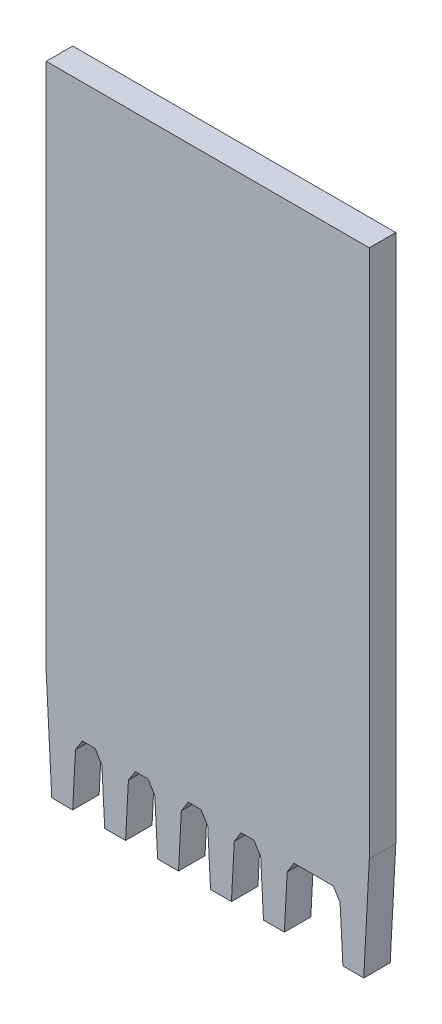
from build123d import *

# Parameters (mm, degrees)
BOSS_EXTRUDE1_DEPTH = 1.5


with BuildPart() as part:
    # Sketch1 → Boss-Extrude1 (new body)
    with BuildSketch(Plane.XY):
        Polygon((0, 6), (0.314446676, 0), (1.497941481, 0), (1.657221927, 3.039251967), (2.042586863, 3.65596478), (2.769801294, 3.65596478), (3.155166229, 3.039251967), (3.314446676, 0), (4.497941481, 0), (4.657221927, 3.039251967), (5.042586863, 3.65596478), (5.769801294, 3.65596478), (6.155166229, 3.039251967), (6.314446676, 0), (7.497941481, 0), (7.657221927, 3.039251967), (8.042586863, 3.65596478), (8.769801294, 3.65596478), (9.155166229, 3.039251967), (9.314446676, 0), (10.497941481, 0), (10.657221927, 3.039251967), (11.042586863, 3.65596478), (11.769801294, 3.65596478), (12.155166229, 3.039251967), (12.314446676, 0), (13.497941481, 0), (13.657221927, 3.039251967), (14.042586863, 3.65596478), (16.269801294, 3.65596478), (16.655166229, 3.039251967), (16.814446676, 0), (17.997941481, 0), (18.312388157, 6), (18.312388157, 36), (0, 36), align=None)
    extrude(amount=BOSS_EXTRUDE1_DEPTH)


solid = part.part
